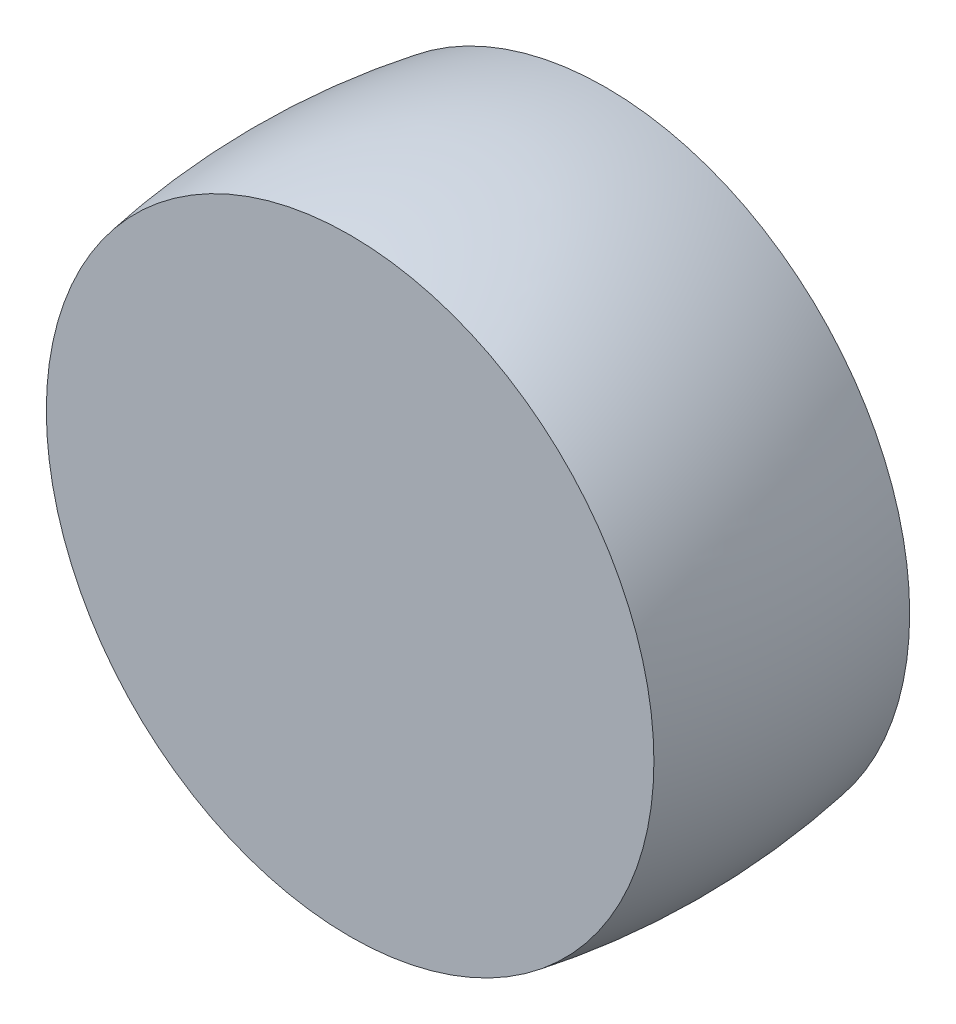
from build123d import *

# Parameters (mm, degrees)
CROQUIS1_R              = 32
SALIENTE_EXTRUIR1_DEPTH = 26
CORTAR_EXTRUIR1_DEPTH   = 16


# Read off the part's stored shape, not the designer's step: Cortar-Revolución-Lámina1
with BuildPart() as part:
    # Croquis1 → Saliente-Extruir1 (new body)
    with BuildSketch(Plane.XY):
        with Locations(Location((0, 0, 0), (0, 0, 180))):
            Circle(CROQUIS1_R)
    extrude(amount=SALIENTE_EXTRUIR1_DEPTH)

    # Cortar-Revolución-Lámina1 outline → Cortar-Revolución-Lámina1 (revolve, cut)
    with BuildSketch(Plane.XZ):
        with BuildLine():
            ThreePointArc((32, 13), (31.720208212, 6.476045289), (30.882887531, 0))
            Line((30.882887531, 0), (32, 0))
            Line((32, 0), (32, 13))
        make_face()
        with BuildLine():
            ThreePointArc((30.882887531, 26), (31.720208212, 19.523954711), (32, 13))
            Line((32, 13), (32, 26))
            Line((32, 26), (30.882887531, 26))
        make_face()
    revolve(axis=Axis((0, 0, 0), (0, 0, 1)), mode=Mode.SUBTRACT)

    # Croquis3 → Cortar-Extruir1 (cut)
    with BuildSketch(Plane(origin=(0, 0, 0), x_dir=(-1, 0, 0), z_dir=(0, 0, -1))):
        Polygon((3.464101615, -6), (6.92820323, 0), (3.464101615, 6), (-3.464101615, 6), (-6.92820323, 0), (-3.464101615, -6), align=None)
    extrude(amount=-CORTAR_EXTRUIR1_DEPTH, mode=Mode.SUBTRACT)


solid = part.part
